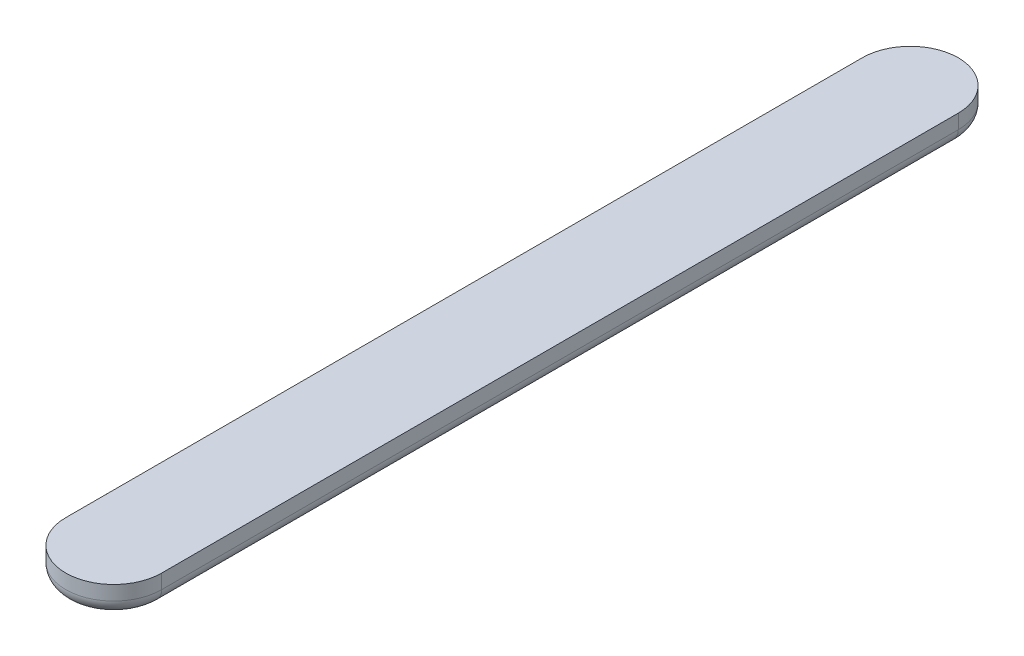
from build123d import *

# Parameters (mm, degrees)
BOSS_EXTRUDE1_DEPTH = 6
CAVITY1_START       = -194.002075021
CAVITY1_DEPTH       = 186.04
CAVITY1_2_ANGLE     = 180
CAVITY1_3_ANGLE     = 180


with BuildPart() as part:
    # Sketch1 → Boss-Extrude1 (new body)
    with BuildSketch(Plane(origin=(0, -28.145825623, 0), x_dir=(1, 0, 0), z_dir=(0, 1, 0))):
        with BuildLine():
            Line((-10, 184.002075021), (-10, 17.962075021))
            ThreePointArc((-10, 17.962075021), (0, 7.962075021), (10, 17.962075021))
            Line((10, 17.962075021), (10, 184.002075021))
            ThreePointArc((10, 184.002075021), (0, 194.002075021), (-10, 184.002075021))
        make_face()
    extrude(amount=-BOSS_EXTRUDE1_DEPTH)

    # Cavity1: read off the stored shape, not the designer's step
    # Cavity1 outline → Cavity1 (cut)
    with BuildSketch(Plane.XY.offset(CAVITY1_START)):
        with BuildLine():
            Line((10, -34.145825623), (10, -31.145825623))
            ThreePointArc((10, -31.145825623), (9.121320344, -33.267145967), (7, -34.145825623))
            Line((7, -34.145825623), (10, -34.145825623))
        make_face()
        with BuildLine():
            Line((-10, -34.145825623), (-7, -34.145825623))
            ThreePointArc((-7, -34.145825623), (-9.121320344, -33.267145967), (-10, -31.145825623))
            Line((-10, -31.145825623), (-10, -34.145825623))
        make_face()
    extrude(amount=CAVITY1_DEPTH, mode=Mode.SUBTRACT)

    # Cavity1 2 outline → Cavity1 2 (revolve, cut)
    with BuildSketch(Plane.XY.offset(-184.002075021)):
        with BuildLine():
            ThreePointArc((10, -31.145825623), (9.121320344, -33.267145967), (7, -34.145825623))
            Line((7, -34.145825623), (10, -34.145825623))
            Line((10, -34.145825623), (10, -31.145825623))
        make_face()
    revolve(axis=Axis((0, 0, -184.002075021), (0, 1, 0)), revolution_arc=CAVITY1_2_ANGLE, mode=Mode.SUBTRACT)

    # Cavity1 3 outline → Cavity1 3 (revolve, cut)
    with BuildSketch(Plane(origin=(0, 0, -17.962075021), x_dir=(-1, 0, 0), z_dir=(0, 0, -1))):
        with BuildLine():
            ThreePointArc((10, -31.145825623), (9.121320344, -33.267145967), (7, -34.145825623))
            Line((7, -34.145825623), (10, -34.145825623))
            Line((10, -34.145825623), (10, -31.145825623))
        make_face()
    revolve(axis=Axis((0, 0, -17.962075021), (0, 1, 0)), revolution_arc=CAVITY1_3_ANGLE, mode=Mode.SUBTRACT)


solid = part.part
